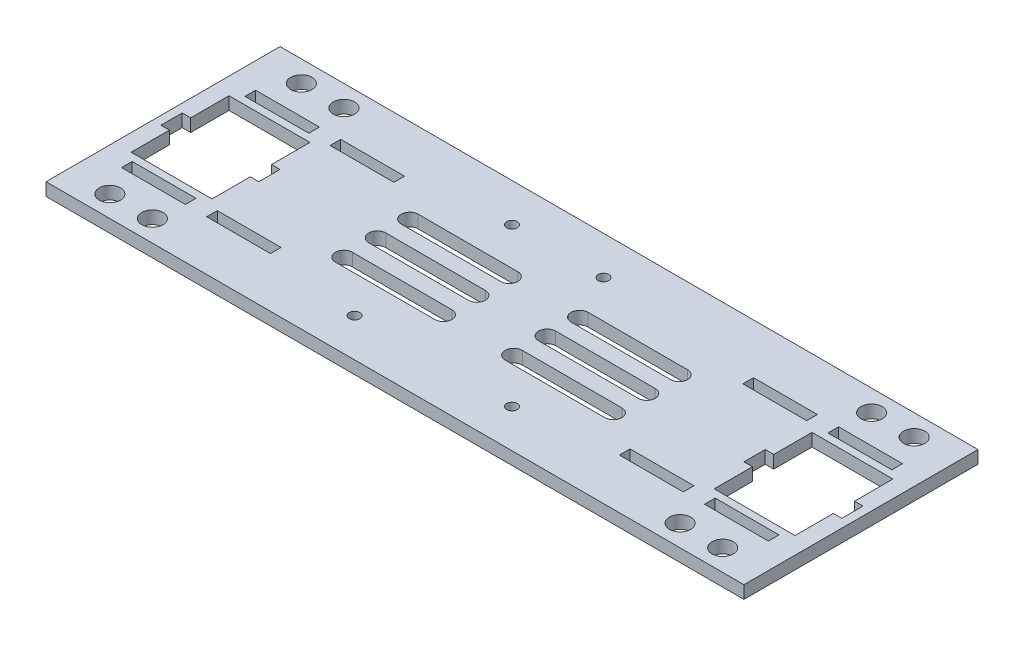
from build123d import *

# Parameters (mm, degrees)
SKETCH1_W           = 164
SKETCH1_H           = 55
SKETCH1_W_2         = 15
SKETCH1_H_2         = 2.5
SKETCH1_W_3         = 19
SKETCH1_H_3         = 23
BOSS_EXTRUDE1_DEPTH = 3
CUT_EXTRUDE1_DEPTH  = 3
SKETCH3_R           = 1.25
CUT_EXTRUDE2_DEPTH  = 10
SKETCH4_R           = 2.5
SKETCH4_W           = 2
SKETCH4_H           = 5
CUT_EXTRUDE3_DEPTH  = 87.540452969


with BuildPart() as part:
    # Sketch1 → Boss-Extrude1 (new body)
    with BuildSketch(Plane(origin=(0, 0, 0), x_dir=(1, 0, 0), z_dir=(0, 1, 0))):
        Rectangle(SKETCH1_W, SKETCH1_H)
        with Locations((48.5, 14.5)):
            Rectangle(SKETCH1_W_2, SKETCH1_H_2, mode=Mode.SUBTRACT)
        with Locations((68.5, 14.5)):
            Rectangle(SKETCH1_W_2, SKETCH1_H_2, mode=Mode.SUBTRACT)
        with Locations((68.5, 0)):
            Rectangle(SKETCH1_W_3, SKETCH1_H_3, mode=Mode.SUBTRACT)
        with Locations((68.5, -14.5)):
            Rectangle(SKETCH1_W_2, SKETCH1_H_2, mode=Mode.SUBTRACT)
        with Locations((48.5, -14.5)):
            Rectangle(SKETCH1_W_2, SKETCH1_H_2, mode=Mode.SUBTRACT)
        with Locations((-48.5, -14.5)):
            Rectangle(SKETCH1_W_2, SKETCH1_H_2, mode=Mode.SUBTRACT)
        with Locations((-68.5, -14.5)):
            Rectangle(SKETCH1_W_2, SKETCH1_H_2, mode=Mode.SUBTRACT)
        with Locations((-68.5, 0)):
            Rectangle(SKETCH1_W_3, SKETCH1_H_3, mode=Mode.SUBTRACT)
        with Locations((-68.5, 14.5)):
            Rectangle(SKETCH1_W_2, SKETCH1_H_2, mode=Mode.SUBTRACT)
        with Locations((-48.5, 14.5)):
            Rectangle(SKETCH1_W_2, SKETCH1_H_2, mode=Mode.SUBTRACT)
    extrude(amount=BOSS_EXTRUDE1_DEPTH)

    # Sketch2 → Cut-Extrude1 (cut)
    with BuildSketch(Plane(origin=(0, 3, 0), x_dir=(1, 0, 0), z_dir=(0, 1, 0))):
        with BuildLine():
            Line((-31.658505885, 2), (-8.266387648, 2))
            ThreePointArc((-8.266387648, 2), (-6.266387648, 0), (-8.266387648, -2))
            Line((-8.266387648, -2), (-31.658505885, -2))
            ThreePointArc((-31.658505885, -2), (-33.658505885, 0), (-31.658505885, 2))
        make_face()
        with BuildLine():
            Line((31.658505885, -9.856733432), (8.266387648, -9.856733432))
            ThreePointArc((8.266387648, -9.856733432), (6.266387648, -7.856733432), (8.266387648, -5.856733432))
            Line((8.266387648, -5.856733432), (31.658505885, -5.856733432))
            ThreePointArc((31.658505885, -5.856733432), (33.658505885, -7.856733432), (31.658505885, -9.856733432))
        make_face()
        with BuildLine():
            Line((-31.658505885, 9.620758334), (-8.266387648, 9.620758334))
            ThreePointArc((-8.266387648, 9.620758334), (-6.266387648, 7.620758334), (-8.266387648, 5.620758334))
            Line((-8.266387648, 5.620758334), (-31.658505885, 5.620758334))
            ThreePointArc((-31.658505885, 5.620758334), (-33.658505885, 7.620758334), (-31.658505885, 9.620758334))
        make_face()
        with BuildLine():
            Line((31.658505885, 5.620758334), (8.266387648, 5.620758334))
            ThreePointArc((8.266387648, 5.620758334), (6.266387648, 7.620758334), (8.266387648, 9.620758334))
            Line((8.266387648, 9.620758334), (31.658505885, 9.620758334))
            ThreePointArc((31.658505885, 9.620758334), (33.658505885, 7.620758334), (31.658505885, 5.620758334))
        make_face()
        with BuildLine():
            Line((-31.658505885, -5.856733432), (-8.266387648, -5.856733432))
            ThreePointArc((-8.266387648, -5.856733432), (-6.266387648, -7.856733432), (-8.266387648, -9.856733432))
            Line((-8.266387648, -9.856733432), (-31.658505885, -9.856733432))
            ThreePointArc((-31.658505885, -9.856733432), (-33.658505885, -7.856733432), (-31.658505885, -5.856733432))
        make_face()
        with BuildLine():
            Line((31.658505885, -2), (8.266387648, -2))
            ThreePointArc((8.266387648, -2), (6.266387648, 0), (8.266387648, 2))
            Line((8.266387648, 2), (31.658505885, 2))
            ThreePointArc((31.658505885, 2), (33.658505885, 0), (31.658505885, -2))
        make_face()
    extrude(amount=-CUT_EXTRUDE1_DEPTH, mode=Mode.SUBTRACT)

    # Sketch3 → Cut-Extrude2 (cut)
    with BuildSketch(Plane(origin=(0, 3, 0), x_dir=(1, 0, 0), z_dir=(0, 1, 0))):
        with Locations((18.5, -18.5)):
            Circle(SKETCH3_R)
        with Locations((-18.5, -18.5)):
            Circle(SKETCH3_R)
        with Locations((-18.5, 18.5)):
            Circle(SKETCH3_R)
        with Locations((3, 18.5)):
            Circle(SKETCH3_R)
    extrude(amount=-CUT_EXTRUDE2_DEPTH, mode=Mode.SUBTRACT)

    # Sketch4 → Cut-Extrude3 (cut, through all)
    with BuildSketch(Plane(origin=(0, 3, 0), x_dir=(1, 0, 0), z_dir=(0, 1, 0))):
        with Locations((72, -22.5)):
            Circle(SKETCH4_R)
        with Locations((62, -22.5)):
            Circle(SKETCH4_R)
        with Locations((72, 22.5)):
            Circle(SKETCH4_R)
        with Locations((62, 22.5)):
            Circle(SKETCH4_R)
        with Locations((-72, 22.5)):
            Circle(SKETCH4_R)
        with Locations((-62, 22.5)):
            Circle(SKETCH4_R)
        with Locations((-72, -22.5)):
            Circle(SKETCH4_R)
        with Locations((-62, -22.5)):
            Circle(SKETCH4_R)
        with Locations((-79, 0)):
            Rectangle(SKETCH4_W, SKETCH4_H)
        with Locations((-58, 0)):
            Rectangle(SKETCH4_W, SKETCH4_H)
        with Locations((58, 0)):
            Rectangle(SKETCH4_W, SKETCH4_H)
        with Locations((79, 0)):
            Rectangle(SKETCH4_W, SKETCH4_H)
    extrude(amount=-CUT_EXTRUDE3_DEPTH, mode=Mode.SUBTRACT)


solid = part.part
